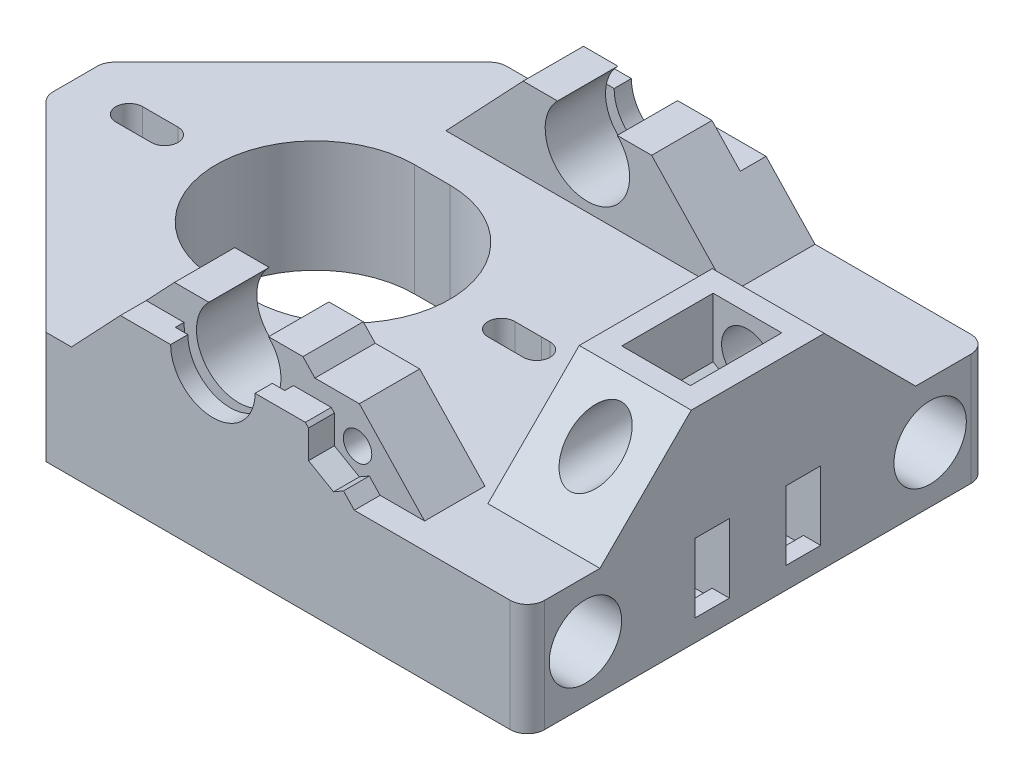
from build123d import *

# Parameters (mm, degrees)
BOSS_EXTRUDE2_DEPTH      = 13
CUT_EXTRUDE6_DEPTH       = 43.108996013
CUT_EXTRUDE7_DEPTH       = 43.108996013
CUT_EXTRUDE8_DEPTH       = 13
SKETCH7_R                = 4.2
CUT_EXTRUDE9_DEPTH       = 30
BOSS_EXTRUDE3_DEPTH      = 10
CUT_EXTRUDE10_DEPTH      = 1
SKETCH13_R               = 4.2
BOSS_EXTRUDE4_DEPTH      = 20.09
SKETCH17_W               = 13
SKETCH17_H               = 15.432451
BOSS_EXTRUDE5_DEPTH      = 10.6
CHAMFER1_SIZE            = 10.6
SKETCH12_R               = 3
CUT_EXTRUDE11_DEPTH      = 77.770333281
CUT_EXTRUDE12_START      = -6.148636
CUT_EXTRUDE12_DEPTH      = 5.3
FILLET2_R                = 2
SKETCH25_W               = 86.308607618
SKETCH25_H               = 69.103285455
CUT_EXTRUDE13_DEPTH      = 0.00151491
CUT_EXTRUDE14_DEPTH      = 58.985456967
CUT_EXTRUDE15_REACH      = 89.237
CUT_EXTRUDE15_END_RADIUS = 11.5
SKETCH27_W               = 4
SKETCH27_H               = 8
SKETCH30_W               = 15.219906176
SKETCH30_H               = 7
BOSS_EXTRUDE6_DEPTH      = 8
SKETCH28_W               = 26.149590075
SKETCH28_H               = 8.463351347
CUT_EXTRUDE16_DEPTH      = 3
CUT_EXTRUDE17_DEPTH      = 3
SKETCH33_R               = 1.2
CUT_EXTRUDE19_DEPTH      = 10
FILLET9_R                = 2
SKETCH32_R               = 1.65
CUT_EXTRUDE20_DEPTH      = 10
SKETCH34_R               = 4.2
BOSS_EXTRUDE7_DEPTH      = 5
CUT_EXTRUDE22_START      = -13
CUT_EXTRUDE22_DEPTH      = 13
CUT_EXTRUDE23_DEPTH      = 58.985456967
CUT_EXTRUDE24_START      = -1
CUT_EXTRUDE24_DEPTH      = 10
CUT_EXTRUDE25_REACH      = 76.711


# Read off the part's stored shape, not the designer's step: Cut-Extrude22
with BuildPart() as part:
    # Sketch1 → Boss-Extrude2 (new body)
    with BuildSketch(Plane(origin=(0, 0, 0), x_dir=(1, 0, 0), z_dir=(0, 1, 0))):
        Polygon((-2.969848481, 26.728636329), (-6.906313813, 26.728636329), (-29.828636329, 3.806313813), (-29.828636329, -2.969848481), (-6.069848481, -26.728636329), (-2.969848481, -26.728636329), (2.969848481, -26.728636329), (29.69848481, -26.728636329), (29.69848481, 26.728636329), (2.969848481, 26.728636329), align=None)
    extrude(amount=BOSS_EXTRUDE2_DEPTH)

    # Sketch1<8> → Cut-Extrude6 (cut, through all)
    with BuildSketch(Plane(origin=(0, 0, 0), x_dir=(1, 0, 0), z_dir=(0, 1, 0))):
        with BuildLine():
            Line((-23.14, -1.55), (-20.04, -1.55))
            ThreePointArc((-20.04, -1.55), (-18.49, 0), (-20.04, 1.55))
            Line((-20.04, 1.55), (-23.14, 1.55))
            ThreePointArc((-23.14, 1.55), (-24.69, 0), (-23.14, -1.55))
        make_face()
    extrude(amount=CUT_EXTRUDE6_DEPTH, mode=Mode.SUBTRACT)

    # Sketch1<9> → Cut-Extrude7 (cut, through all)
    with BuildSketch(Plane(origin=(0, 0, 0), x_dir=(1, 0, 0), z_dir=(0, 1, 0))):
        with BuildLine():
            Line((9.28999972, -8.505433812), (9.28999972, 8.505433812))
            ThreePointArc((9.28999972, 8.505433812), (5.69954884, 10.725261974), (1.55, 11.5))
            Line((1.55, 11.5), (-1.55, 11.5))
            ThreePointArc((-1.55, 11.5), (-13.05, 0), (-1.55, -11.5))
            Line((-1.55, -11.5), (1.55, -11.5))
            ThreePointArc((1.55, -11.5), (5.69954884, -10.725261974), (9.28999972, -8.505433812))
        make_face()
        with BuildLine():
            ThreePointArc((9.28999972, -8.505433812), (13.05, 0), (9.28999972, 8.505433812))
            Line((9.28999972, 8.505433812), (9.28999972, -8.505433812))
        make_face()
    extrude(amount=CUT_EXTRUDE7_DEPTH, mode=Mode.SUBTRACT)

    # Sketch1<11> → Cut-Extrude8 (cut)
    with BuildSketch(Plane(origin=(0, 0, 0), x_dir=(1, 0, 0), z_dir=(0, 1, 0))):
        with BuildLine():
            Line((23.139619127, 1.551521906), (20.03999972, 1.550761))
            ThreePointArc((20.03999972, 1.550761), (18.48961936, 0), (20.03999972, -1.550761))
            Line((20.03999972, -1.550761), (23.14, -1.551521999))
            ThreePointArc((23.14, -1.551521999), (24.691521964, 0.000190413), (23.139619127, 1.551521906))
        make_face()
        with BuildLine():
            ThreePointArc((21.589619103, -0.059493857), (21.588478024, -1.2e-08), (21.589619104, 0.059493833))
            ThreePointArc((21.589619104, 0.059493833), (21.590760744, -1.2e-08), (21.589619103, -0.059493857))
        make_face(mode=Mode.SUBTRACT)
    extrude(amount=CUT_EXTRUDE8_DEPTH, mode=Mode.SUBTRACT)


with BuildPart() as cut_extrude8_piece_1:
    # of the separate pieces the step leaves, piece 1, a body of its own (cut_extrude8_pieces)
    add(part.part.solids().sort_by_distance((-6.906313813, 0, -26.728636329))[0])

    # Sketch7 → Cut-Extrude9 (cut)
    with BuildSketch(Plane(origin=(29.69848481, 0, 0), x_dir=(0, 0, -1), z_dir=(1, 0, 0))):
        with Locations((-20, 6.5)):
            Circle(SKETCH7_R)
        with Locations((20, 6.5)):
            Circle(SKETCH7_R)
    extrude(amount=-CUT_EXTRUDE9_DEPTH, mode=Mode.SUBTRACT)

    # Sketch9 → Boss-Extrude3 (add)
    with BuildSketch(Plane.XY.offset(26.728636329)):
        with BuildLine():
            Line((-3.11848537, 13), (29.69848481, 13))
            Line((29.69848481, 13), (20.745211893, 22.464823228))
            Line((20.745211893, 22.464823228), (16.754822948, 22.464823228))
            ThreePointArc((16.754822948, 22.464823228), (13.28999972, 14.1), (9.825176492, 22.464823228))
            Line((9.825176492, 22.464823228), (5.834787547, 22.464823228))
            Line((5.834787547, 22.464823228), (-3.11848537, 13))
        make_face()
    boss_extrude3 = extrude(amount=-BOSS_EXTRUDE3_DEPTH)

    # Sketch10 → Cut-Extrude10 (cut)
    with BuildSketch(Plane.XY.offset(24.728636329)):
        with BuildLine():
            Line((6.93999972, 19), (6.93999972, 29.430631577))
            Line((6.93999972, 29.430631577), (19.63999972, 29.430631577))
            Line((19.63999972, 29.430631577), (19.63999972, 19))
            ThreePointArc((19.63999972, 19), (13.28999972, 12.65), (6.93999972, 19))
        make_face()
    cut_extrude10 = extrude(amount=-CUT_EXTRUDE10_DEPTH, mode=Mode.SUBTRACT)

    # Mirror1: Boss-Extrude3, Cut-Extrude10 across plane
    add(boss_extrude3.mirror(Plane.XY))
    add(cut_extrude10.mirror(Plane.XY), mode=Mode.SUBTRACT)

    # Sketch13 → Boss-Extrude4 (add)
    with BuildSketch(Plane(origin=(29.69848481, 0, 0), x_dir=(0, 0, -1), z_dir=(1, 0, 0))):
        Polygon((-26.728636329, 0), (26.728636329, 0), (26.728636329, 13), (16.728636329, 13), (-16.728636329, 13), (-26.728636329, 13), align=None)
        with Locations((-20, 6.5)):
            Circle(SKETCH13_R, mode=Mode.SUBTRACT)
        with Locations((20, 6.5)):
            Circle(SKETCH13_R, mode=Mode.SUBTRACT)
    extrude(amount=BOSS_EXTRUDE4_DEPTH)

    # Sketch17 → Boss-Extrude5 (add)
    with BuildSketch(Plane(origin=(0, 13, 0), x_dir=(1, 0, 0), z_dir=(0, 1, 0))):
        with Locations((43.28999972, 0)):
            Rectangle(SKETCH17_W, SKETCH17_H)
    extrude(amount=BOSS_EXTRUDE5_DEPTH)

    # Chamfer1
    # the kernel refuses this chamfer: 10.6 mm, written as the material it adds along each edge
    with BuildSketch(Plane(origin=(49.78848481, 13, 7.7162255), x_dir=(0, -0.027495876610586376, 0.9996219169112966), z_dir=(-1, 0, 0)), Plane(origin=(36.78999972, 13, -7.7162255), x_dir=(0, -0.02749587661058638, -0.9996219169112966), z_dir=(1, 0, 0))) as chamfer1_piece_1:
        Polygon((CHAMFER1_SIZE * 0.999621916911, CHAMFER1_SIZE * 0.0274958766106), (-CHAMFER1_SIZE * 0.0274958766106, CHAMFER1_SIZE * 0.999621916911), (0, 0), align=None)
    extrude(amount=12.99848509)

    # Sketch12 → Cut-Extrude11 (cut, through all)
    with BuildSketch(Plane.XY.offset(26.728636329)):
        with Locations(Location((43.28999972, 19, 0), (0, 0, 270))):
            Circle(SKETCH12_R)
    extrude(amount=-CUT_EXTRUDE11_DEPTH, mode=Mode.SUBTRACT)

    # Sketch24 → Cut-Extrude12 (cut)
    with BuildSketch(Plane.XY.offset(6.148636329).offset(CUT_EXTRUDE12_START)):
        Polygon((47.273716577, 23.6), (47.273716577, 21.3), (47.273716577, 16.7), (43.28999972, 14.4), (39.306282862, 16.7), (39.306282862, 21.3), (39.306282862, 23.6), align=None)
    cut_extrude12 = extrude(amount=-CUT_EXTRUDE12_DEPTH, mode=Mode.SUBTRACT)

    # Fillet2
    fillet2_edges = [cut_extrude8_piece_1.edges().sort_by_distance(p)[0] for p in [
        (49.78848481, 6.5, 26.728636329),
        (49.78848481, 6.5, -26.728636329),
    ]]
    fillet(fillet2_edges, radius=FILLET2_R)

    # Sketch25 → Cut-Extrude13 (cut)
    with BuildSketch(Plane(origin=(49.78999972, 0, 0), x_dir=(0, 0, -1), z_dir=(1, 0, 0))):
        with Locations((0, 8.901936044)):
            Rectangle(SKETCH25_W, SKETCH25_H)
    extrude(amount=-CUT_EXTRUDE13_DEPTH, mode=Mode.SUBTRACT)

    # Cut-Extrude15: up to this cylinder (the profile starts outside it)
    cut_extrude15_end = Plane(origin=(1.55, 6.5, 0), z_dir=(0, -1, 0)) * Cylinder(CUT_EXTRUDE15_END_RADIUS, 202.474, mode=Mode.PRIVATE)
    # Sketch27 → Cut-Extrude15 (cut, up to the surface)
    with BuildSketch(Plane(origin=(49.78848481, 0, 0), x_dir=(0, 0, -1), z_dir=(1, 0, 0)), mode=Mode.PRIVATE) as cut_extrude15_sk1:
        with Locations((-5.3, 6.5)):
            Rectangle(SKETCH27_W, SKETCH27_H)
    cut_extrude15_tool1 = extrude(cut_extrude15_sk1.sketch, amount=-CUT_EXTRUDE15_REACH, mode=Mode.PRIVATE) - cut_extrude15_end
    cut_extrude15 = cut_extrude15_tool1.solids().sort_by_distance((49.788485, 6.5, 5.3))[0]
    add(cut_extrude15, mode=Mode.SUBTRACT)

    # Mirror2: Cut-Extrude15 across plane
    add(cut_extrude15.mirror(Plane.XY), mode=Mode.SUBTRACT)

    # Mirror3: Cut-Extrude12 across plane
    add(cut_extrude12.mirror(Plane.XY), mode=Mode.SUBTRACT)

    # Sketch30 → Boss-Extrude6 (add)
    with BuildSketch(Plane(origin=(0, 13, 0), x_dir=(1, 0, 0), z_dir=(0, 1, 0))):
        with Locations((27.249952808, -20.228636329)):
            Rectangle(SKETCH30_W, SKETCH30_H)
    extrude(amount=BOSS_EXTRUDE6_DEPTH)

    # Sketch28 → Cut-Extrude16 (cut)
    with BuildSketch(Plane.XY.offset(26.728636329)):
        with Locations((11.690030011, 23.231675673)):
            Rectangle(SKETCH28_W, SKETCH28_H)
    cut_extrude16 = extrude(amount=-CUT_EXTRUDE16_DEPTH, mode=Mode.SUBTRACT)

    # Mirror4: Cut-Extrude16 across plane
    add(cut_extrude16.mirror(Plane.XY), mode=Mode.SUBTRACT)

    # Sketch31 → Cut-Extrude17 (cut)
    with BuildSketch(Plane.XY.offset(26.728636329)):
        Polygon((27.28999972, 20.348631561), (24.38999972, 18.674315781), (24.38999972, 15.325684219), (27.28999972, 13.651368439), (30.18999972, 15.325684219), (30.18999972, 18.674315781), align=None)
    extrude(amount=-CUT_EXTRUDE17_DEPTH, mode=Mode.SUBTRACT)

    # Sketch33 → Cut-Extrude19 (cut)
    with BuildSketch(Plane.XZ):
        with Locations(Location((46.28848481, 0, 0), (0, 0, 270))):
            Circle(SKETCH33_R)
    extrude(amount=-CUT_EXTRUDE19_DEPTH, mode=Mode.SUBTRACT)

    # Fillet9
    fillet9_edges = [cut_extrude8_piece_1.edges().sort_by_distance(p)[0] for p in [
        (-6.906313813, 6.5, -26.728636329),
        (-29.828636329, 6.5, -3.806313813),
        (-29.828636329, 6.5, 2.969848481),
    ]]
    fillet(fillet9_edges, radius=FILLET9_R)

    # Sketch32 → Cut-Extrude20 (cut)
    with BuildSketch(Plane.XY.offset(23.728636329)):
        with Locations((27.079904605, 16.636104587)):
            Circle(SKETCH32_R)
    extrude(amount=-CUT_EXTRUDE20_DEPTH, mode=Mode.SUBTRACT)

    # Sketch34 → Boss-Extrude7 (add)
    with BuildSketch(Plane(origin=(-0.30151519, 0, 0), x_dir=(0, 0, -1), z_dir=(1, 0, 0))):
        with Locations((-20, 6.5)):
            Circle(SKETCH34_R)
        with Locations((20, 6.5)):
            Circle(SKETCH34_R)
    extrude(amount=BOSS_EXTRUDE7_DEPTH)

    # Cut-Extrude22 outline → Cut-Extrude22 (cut)
    with BuildSketch(Plane(origin=(0, 13, 0), x_dir=(1, 0, 0), z_dir=(0, 1, 0)).offset(CUT_EXTRUDE22_START)):
        with BuildLine():
            ThreePointArc((-20.04, 1.55), (-18.49, 0), (-20.04, -1.55))
            Line((-20.04, -1.55), (-19.04, -1.55))
            ThreePointArc((-19.04, -1.55), (-17.49, 0), (-19.04, 1.55))
            Line((-19.04, 1.55), (-20.04, 1.55))
        make_face()
        with BuildLine():
            Line((24.139625451, 1.551521906), (23.14, 1.551521953))
            ThreePointArc((23.14, 1.551521953), (24.691521976, -2.3e-08), (23.14, -1.551521999))
            Line((23.14, -1.551521999), (24.139751204, -1.551521977))
            ThreePointArc((24.139751204, -1.551521977), (25.691147394, 6.2838e-05), (24.139625451, 1.551521906))
        make_face()
    extrude(amount=CUT_EXTRUDE22_DEPTH, mode=Mode.SUBTRACT)

    # Sketch38 → Cut-Extrude23 (cut, through all)
    with BuildSketch(Plane(origin=(0, 13, 0), x_dir=(1, 0, 0), z_dir=(0, 1, 0))):
        with BuildLine():
            ThreePointArc((1.55, 11.5), (13.05, 0), (1.55, -11.5))
            Line((1.55, -11.5), (2.55, -11.5))
            ThreePointArc((2.55, -11.5), (14.05, 0), (2.55, 11.5))
            Line((2.55, 11.5), (1.55, 11.5))
        make_face()
    extrude(amount=-CUT_EXTRUDE23_DEPTH, mode=Mode.SUBTRACT)

    # Sketch39 → Cut-Extrude24 (cut)
    with BuildSketch(Plane(origin=(0, 2.5, 0), x_dir=(1, 0, 0), z_dir=(0, 1, 0)).offset(CUT_EXTRUDE24_START)):
        with BuildLine():
            Line((47.78848481, 7.3), (13.906055653, 7.3))
            ThreePointArc((13.906055653, 7.3), (14.935796911, 5.370478086), (15.640454538, 3.3))
            Line((15.640454538, 3.3), (47.78848481, 3.3))
            Line((47.78848481, 3.3), (47.78848481, 7.3))
        make_face()
        with BuildLine():
            Line((13.906055653, -7.3), (47.78848481, -7.3))
            Line((47.78848481, -7.3), (47.78848481, -3.3))
            Line((47.78848481, -3.3), (15.640454538, -3.3))
            ThreePointArc((15.640454538, -3.3), (14.935796911, -5.370478086), (13.906055653, -7.3))
        make_face()
    extrude(amount=CUT_EXTRUDE24_DEPTH, mode=Mode.SUBTRACT)

    # Sketch40 → Cut-Extrude25 (cut, up to next)
    with BuildSketch(Plane.XY.offset(23.728636329), mode=Mode.PRIVATE) as cut_extrude25_sk1:
        Polygon((34.859905896, 13), (27.29228613, 21), (34.859905896, 21), align=None)
    cut_extrude25_tool1 = extrude(cut_extrude25_sk1.sketch, amount=-CUT_EXTRUDE25_REACH, mode=Mode.PRIVATE) & cut_extrude8_piece_1.part
    add(cut_extrude25_tool1.solids().sort_by_distance((32.337366, 18.333333, 23.728636))[0], mode=Mode.SUBTRACT)


with BuildPart() as cut_extrude8_piece_2:
    # of the separate pieces the step leaves, piece 2, a body of its own (cut_extrude8_pieces)
    add(part.part.solids().sort_by_distance((21.589619104, 0, -0.059493833))[0])

    # Sketch26 → Cut-Extrude14 (cut, through all)
    with BuildSketch(Plane(origin=(0, 13, 0), x_dir=(1, 0, 0), z_dir=(0, 1, 0))):
        with BuildLine():
            ThreePointArc((21.589619104, 0.059493833), (21.588478024, -1.2e-08), (21.589619103, -0.059493857))
            ThreePointArc((21.589619103, -0.059493857), (21.590760744, -1.2e-08), (21.589619104, 0.059493833))
        make_face()
    extrude(amount=-CUT_EXTRUDE14_DEPTH, mode=Mode.SUBTRACT)


solid = cut_extrude8_piece_1.part
